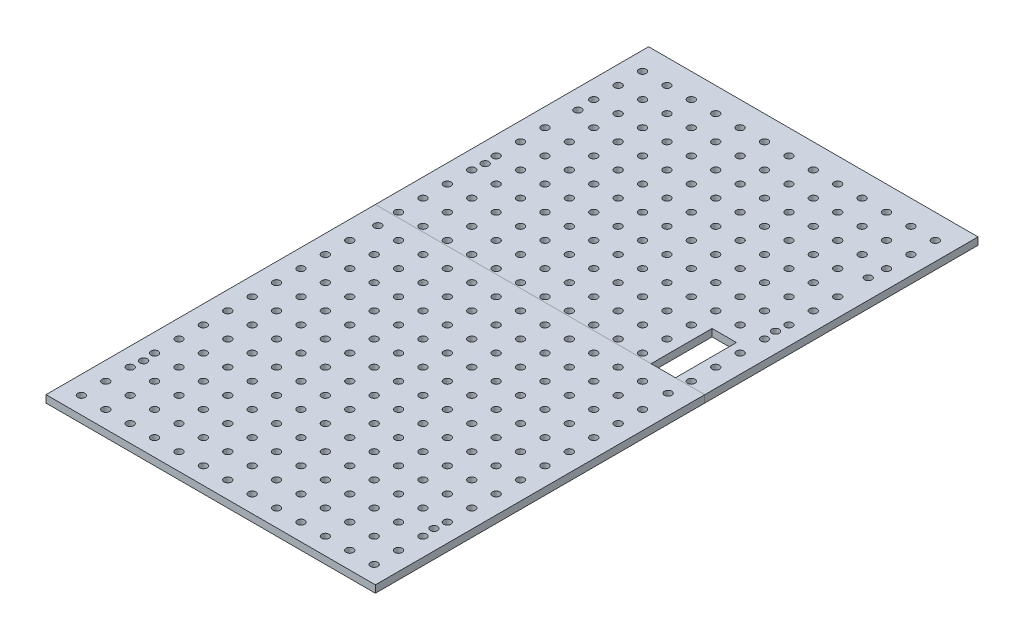
from build123d import *

# Parameters (mm, degrees)
SKETCH1_W               = 135
SKETCH1_H               = 247
BOSS_EXTRUDE1_DEPTH     = 3
CUT_EXTRUDE3_REACH      = 142.775
SKETCH5_R               = 1.5
SKETCH5_W               = 10
SKETCH5_H               = 25
CUT_EXTRUDE5_DEPTH      = 100
CUT_EXTRUDE5_DEPTH_BACK = 141.774642603
SKETCH6_R               = 1.5
BOSS_EXTRUDE2_START     = 2
SKETCH7_R               = 2.5
SKETCH7_R_2             = 1.5
BOSS_EXTRUDE2_DEPTH     = 2


# Read off the part's stored shape, not the designer's step: Split1
with BuildPart() as part:
    # Sketch1 → Boss-Extrude1 (new body)
    with BuildSketch(Plane(origin=(0, 0, 0), x_dir=(1, 0, 0), z_dir=(0, 1, 0))):
        Rectangle(SKETCH1_W, SKETCH1_H)
    extrude(amount=BOSS_EXTRUDE1_DEPTH)

    # Sketch5 → Cut-Extrude3 (cut, up to next)
    with BuildSketch(Plane.XZ, mode=Mode.PRIVATE) as cut_extrude3_sk1:
        with Locations(Location((59.5, 91.5, 0), (0, 0, 270))):
            Circle(SKETCH5_R)
    cut_extrude3_tool1 = extrude(cut_extrude3_sk1.sketch, amount=-CUT_EXTRUDE3_REACH, mode=Mode.PRIVATE) & part.part
    # Sketch5 → Cut-Extrude3 (cut, up to next)
    with BuildSketch(Plane.XZ, mode=Mode.PRIVATE) as cut_extrude3_sk2:
        with Locations(Location((59.5, -4.5, 0), (0, 0, 270))):
            Circle(SKETCH5_R)
    cut_extrude3_tool2 = extrude(cut_extrude3_sk2.sketch, amount=-CUT_EXTRUDE3_REACH, mode=Mode.PRIVATE) & part.part
    # Sketch5 → Cut-Extrude3 (cut, up to next)
    with BuildSketch(Plane.XZ, mode=Mode.PRIVATE) as cut_extrude3_sk3:
        with Locations(Location((59.5, -48.5, 0), (0, 0, 270))):
            Circle(SKETCH5_R)
    cut_extrude3_tool3 = extrude(cut_extrude3_sk3.sketch, amount=-CUT_EXTRUDE3_REACH, mode=Mode.PRIVATE) & part.part
    # Sketch5 → Cut-Extrude3 (cut, up to next)
    with BuildSketch(Plane.XZ, mode=Mode.PRIVATE) as cut_extrude3_sk4:
        with Locations(Location((59.5, -86.5, 0), (0, 0, 270))):
            Circle(SKETCH5_R)
    cut_extrude3_tool4 = extrude(cut_extrude3_sk4.sketch, amount=-CUT_EXTRUDE3_REACH, mode=Mode.PRIVATE) & part.part
    # Sketch5 → Cut-Extrude3 (cut, up to next)
    with BuildSketch(Plane.XZ, mode=Mode.PRIVATE) as cut_extrude3_sk5:
        with Locations(Location((-59.5, -86.5, 0), (0, 0, 270))):
            Circle(SKETCH5_R)
    cut_extrude3_tool5 = extrude(cut_extrude3_sk5.sketch, amount=-CUT_EXTRUDE3_REACH, mode=Mode.PRIVATE) & part.part
    # Sketch5 → Cut-Extrude3 (cut, up to next)
    with BuildSketch(Plane.XZ, mode=Mode.PRIVATE) as cut_extrude3_sk6:
        with Locations(Location((-59.5, -48.5, 0), (0, 0, 270))):
            Circle(SKETCH5_R)
    cut_extrude3_tool6 = extrude(cut_extrude3_sk6.sketch, amount=-CUT_EXTRUDE3_REACH, mode=Mode.PRIVATE) & part.part
    # Sketch5 → Cut-Extrude3 (cut, up to next)
    with BuildSketch(Plane.XZ, mode=Mode.PRIVATE) as cut_extrude3_sk7:
        with Locations(Location((-59.5, -4.5, 0), (0, 0, 270))):
            Circle(SKETCH5_R)
    cut_extrude3_tool7 = extrude(cut_extrude3_sk7.sketch, amount=-CUT_EXTRUDE3_REACH, mode=Mode.PRIVATE) & part.part
    # Sketch5 → Cut-Extrude3 (cut, up to next)
    with BuildSketch(Plane.XZ, mode=Mode.PRIVATE) as cut_extrude3_sk8:
        with Locations(Location((-59.5, 91.5, 0), (0, 0, 270))):
            Circle(SKETCH5_R)
    cut_extrude3_tool8 = extrude(cut_extrude3_sk8.sketch, amount=-CUT_EXTRUDE3_REACH, mode=Mode.PRIVATE) & part.part
    # Sketch5 → Cut-Extrude3 (cut, up to next)
    with BuildSketch(Plane.XZ, mode=Mode.PRIVATE) as cut_extrude3_sk9:
        with Locations((50.5, -24)):
            Rectangle(SKETCH5_W, SKETCH5_H)
    cut_extrude3_tool9 = extrude(cut_extrude3_sk9.sketch, amount=-CUT_EXTRUDE3_REACH, mode=Mode.PRIVATE) & part.part
    add(cut_extrude3_tool1.solids().sort_by_distance((59.5, 0, 91.5))[0], mode=Mode.SUBTRACT)
    add(cut_extrude3_tool2.solids().sort_by_distance((59.5, 0, -4.5))[0], mode=Mode.SUBTRACT)
    add(cut_extrude3_tool3.solids().sort_by_distance((59.5, 0, -48.5))[0], mode=Mode.SUBTRACT)
    add(cut_extrude3_tool4.solids().sort_by_distance((59.5, 0, -86.5))[0], mode=Mode.SUBTRACT)
    add(cut_extrude3_tool5.solids().sort_by_distance((-59.5, 0, -86.5))[0], mode=Mode.SUBTRACT)
    add(cut_extrude3_tool6.solids().sort_by_distance((-59.5, 0, -48.5))[0], mode=Mode.SUBTRACT)
    add(cut_extrude3_tool7.solids().sort_by_distance((-59.5, 0, -4.5))[0], mode=Mode.SUBTRACT)
    add(cut_extrude3_tool8.solids().sort_by_distance((-59.5, 0, 91.5))[0], mode=Mode.SUBTRACT)
    add(cut_extrude3_tool9.solids().sort_by_distance((50.5, 0, -24))[0], mode=Mode.SUBTRACT)

    # Sketch6 → Cut-Extrude5 (cut, two sides: drawn at the far end of the back side and taken through both)
    with BuildSketch(Plane(origin=(0, 3, 0), x_dir=(1, 0, 0), z_dir=(0, 1, 0)).offset(-CUT_EXTRUDE5_DEPTH_BACK)):
        with Locations(Location((0, 113.5, 0), (0, 0, 270))):
            Circle(SKETCH6_R)
        with Locations(Location((10, 113.5, 0), (0, 0, 270))):
            Circle(SKETCH6_R)
        with Locations(Location((20, 113.5, 0), (0, 0, 270))):
            Circle(SKETCH6_R)
        with Locations(Location((30, 113.5, 0), (0, 0, 270))):
            Circle(SKETCH6_R)
        with Locations(Location((40, 113.5, 0), (0, 0, 270))):
            Circle(SKETCH6_R)
        with Locations(Location((50, 113.5, 0), (0, 0, 270))):
            Circle(SKETCH6_R)
        with Locations(Location((10, 103.5, 0), (0, 0, 270))):
            Circle(SKETCH6_R)
        with Locations(Location((20, 103.5, 0), (0, 0, 270))):
            Circle(SKETCH6_R)
        with Locations(Location((30, 103.5, 0), (0, 0, 270))):
            Circle(SKETCH6_R)
        with Locations(Location((40, 103.5, 0), (0, 0, 270))):
            Circle(SKETCH6_R)
        with Locations(Location((50, 103.5, 0), (0, 0, 270))):
            Circle(SKETCH6_R)
        with Locations(Location((10, 93.5, 0), (0, 0, 270))):
            Circle(SKETCH6_R)
        with Locations(Location((20, 93.5, 0), (0, 0, 270))):
            Circle(SKETCH6_R)
        with Locations(Location((30, 93.5, 0), (0, 0, 270))):
            Circle(SKETCH6_R)
        with Locations(Location((40, 93.5, 0), (0, 0, 270))):
            Circle(SKETCH6_R)
        with Locations(Location((50, 93.5, 0), (0, 0, 270))):
            Circle(SKETCH6_R)
        with Locations(Location((10, 83.5, 0), (0, 0, 270))):
            Circle(SKETCH6_R)
        with Locations(Location((20, 83.5, 0), (0, 0, 270))):
            Circle(SKETCH6_R)
        with Locations(Location((30, 83.5, 0), (0, 0, 270))):
            Circle(SKETCH6_R)
        with Locations(Location((40, 83.5, 0), (0, 0, 270))):
            Circle(SKETCH6_R)
        with Locations(Location((50, 83.5, 0), (0, 0, 270))):
            Circle(SKETCH6_R)
        with Locations(Location((10, 73.5, 0), (0, 0, 270))):
            Circle(SKETCH6_R)
        with Locations(Location((20, 73.5, 0), (0, 0, 270))):
            Circle(SKETCH6_R)
        with Locations(Location((30, 73.5, 0), (0, 0, 270))):
            Circle(SKETCH6_R)
        with Locations(Location((40, 73.5, 0), (0, 0, 270))):
            Circle(SKETCH6_R)
        with Locations(Location((50, 73.5, 0), (0, 0, 270))):
            Circle(SKETCH6_R)
        with Locations(Location((10, 63.5, 0), (0, 0, 270))):
            Circle(SKETCH6_R)
        with Locations(Location((20, 63.5, 0), (0, 0, 270))):
            Circle(SKETCH6_R)
        with Locations(Location((30, 63.5, 0), (0, 0, 270))):
            Circle(SKETCH6_R)
        with Locations(Location((40, 63.5, 0), (0, 0, 270))):
            Circle(SKETCH6_R)
        with Locations(Location((50, 63.5, 0), (0, 0, 270))):
            Circle(SKETCH6_R)
        with Locations(Location((10, 53.5, 0), (0, 0, 270))):
            Circle(SKETCH6_R)
        with Locations(Location((20, 53.5, 0), (0, 0, 270))):
            Circle(SKETCH6_R)
        with Locations(Location((30, 53.5, 0), (0, 0, 270))):
            Circle(SKETCH6_R)
        with Locations(Location((40, 53.5, 0), (0, 0, 270))):
            Circle(SKETCH6_R)
        with Locations(Location((50, 53.5, 0), (0, 0, 270))):
            Circle(SKETCH6_R)
        with Locations(Location((10, 43.5, 0), (0, 0, 270))):
            Circle(SKETCH6_R)
        with Locations(Location((20, 43.5, 0), (0, 0, 270))):
            Circle(SKETCH6_R)
        with Locations(Location((30, 43.5, 0), (0, 0, 270))):
            Circle(SKETCH6_R)
        with Locations(Location((40, 43.5, 0), (0, 0, 270))):
            Circle(SKETCH6_R)
        with Locations(Location((50, 43.5, 0), (0, 0, 270))):
            Circle(SKETCH6_R)
        with Locations(Location((10, 33.5, 0), (0, 0, 270))):
            Circle(SKETCH6_R)
        with Locations(Location((20, 33.5, 0), (0, 0, 270))):
            Circle(SKETCH6_R)
        with Locations(Location((30, 33.5, 0), (0, 0, 270))):
            Circle(SKETCH6_R)
        with Locations(Location((40, 33.5, 0), (0, 0, 270))):
            Circle(SKETCH6_R)
        with Locations((50, 33.5)):
            Circle(SKETCH6_R)
        with Locations(Location((10, 23.5, 0), (0, 0, 270))):
            Circle(SKETCH6_R)
        with Locations(Location((20, 23.5, 0), (0, 0, 270))):
            Circle(SKETCH6_R)
        with Locations(Location((30, 23.5, 0), (0, 0, 270))):
            Circle(SKETCH6_R)
        with Locations(Location((40, 23.5, 0), (0, 0, 270))):
            Circle(SKETCH6_R)
        with Locations((50, 23.5)):
            Circle(SKETCH6_R)
        with Locations(Location((10, 13.5, 0), (0, 0, 270))):
            Circle(SKETCH6_R)
        with Locations(Location((20, 13.5, 0), (0, 0, 270))):
            Circle(SKETCH6_R)
        with Locations(Location((30, 13.5, 0), (0, 0, 270))):
            Circle(SKETCH6_R)
        with Locations(Location((40, 13.5, 0), (0, 0, 270))):
            Circle(SKETCH6_R)
        with Locations((50, 13.5)):
            Circle(SKETCH6_R)
        with Locations(Location((10, 3.5, 0), (0, 0, 270))):
            Circle(SKETCH6_R)
        with Locations(Location((20, 3.5, 0), (0, 0, 270))):
            Circle(SKETCH6_R)
        with Locations(Location((30, 3.5, 0), (0, 0, 270))):
            Circle(SKETCH6_R)
        with Locations(Location((40, 3.5, 0), (0, 0, 270))):
            Circle(SKETCH6_R)
        with Locations(Location((50, 3.5, 0), (0, 0, 270))):
            Circle(SKETCH6_R)
        with Locations(Location((10, -6.5, 0), (0, 0, 270))):
            Circle(SKETCH6_R)
        with Locations(Location((20, -6.5, 0), (0, 0, 270))):
            Circle(SKETCH6_R)
        with Locations(Location((30, -6.5, 0), (0, 0, 270))):
            Circle(SKETCH6_R)
        with Locations(Location((40, -6.5, 0), (0, 0, 270))):
            Circle(SKETCH6_R)
        with Locations(Location((50, -6.5, 0), (0, 0, 270))):
            Circle(SKETCH6_R)
        with Locations(Location((10, -16.5, 0), (0, 0, 270))):
            Circle(SKETCH6_R)
        with Locations(Location((20, -16.5, 0), (0, 0, 270))):
            Circle(SKETCH6_R)
        with Locations(Location((30, -16.5, 0), (0, 0, 270))):
            Circle(SKETCH6_R)
        with Locations(Location((40, -16.5, 0), (0, 0, 270))):
            Circle(SKETCH6_R)
        with Locations(Location((50, -16.5, 0), (0, 0, 270))):
            Circle(SKETCH6_R)
        with Locations(Location((10, -26.5, 0), (0, 0, 270))):
            Circle(SKETCH6_R)
        with Locations(Location((20, -26.5, 0), (0, 0, 270))):
            Circle(SKETCH6_R)
        with Locations(Location((30, -26.5, 0), (0, 0, 270))):
            Circle(SKETCH6_R)
        with Locations(Location((40, -26.5, 0), (0, 0, 270))):
            Circle(SKETCH6_R)
        with Locations(Location((50, -26.5, 0), (0, 0, 270))):
            Circle(SKETCH6_R)
        with Locations(Location((10, -36.5, 0), (0, 0, 270))):
            Circle(SKETCH6_R)
        with Locations(Location((20, -36.5, 0), (0, 0, 270))):
            Circle(SKETCH6_R)
        with Locations(Location((30, -36.5, 0), (0, 0, 270))):
            Circle(SKETCH6_R)
        with Locations(Location((40, -36.5, 0), (0, 0, 270))):
            Circle(SKETCH6_R)
        with Locations(Location((50, -36.5, 0), (0, 0, 270))):
            Circle(SKETCH6_R)
        with Locations(Location((10, -46.5, 0), (0, 0, 270))):
            Circle(SKETCH6_R)
        with Locations(Location((20, -46.5, 0), (0, 0, 270))):
            Circle(SKETCH6_R)
        with Locations(Location((30, -46.5, 0), (0, 0, 270))):
            Circle(SKETCH6_R)
        with Locations(Location((40, -46.5, 0), (0, 0, 270))):
            Circle(SKETCH6_R)
        with Locations(Location((50, -46.5, 0), (0, 0, 270))):
            Circle(SKETCH6_R)
        with Locations(Location((10, -56.5, 0), (0, 0, 270))):
            Circle(SKETCH6_R)
        with Locations(Location((20, -56.5, 0), (0, 0, 270))):
            Circle(SKETCH6_R)
        with Locations(Location((30, -56.5, 0), (0, 0, 270))):
            Circle(SKETCH6_R)
        with Locations(Location((40, -56.5, 0), (0, 0, 270))):
            Circle(SKETCH6_R)
        with Locations(Location((50, -56.5, 0), (0, 0, 270))):
            Circle(SKETCH6_R)
        with Locations(Location((10, -66.5, 0), (0, 0, 270))):
            Circle(SKETCH6_R)
        with Locations(Location((20, -66.5, 0), (0, 0, 270))):
            Circle(SKETCH6_R)
        with Locations(Location((30, -66.5, 0), (0, 0, 270))):
            Circle(SKETCH6_R)
        with Locations(Location((40, -66.5, 0), (0, 0, 270))):
            Circle(SKETCH6_R)
        with Locations(Location((50, -66.5, 0), (0, 0, 270))):
            Circle(SKETCH6_R)
        with Locations(Location((10, -76.5, 0), (0, 0, 270))):
            Circle(SKETCH6_R)
        with Locations(Location((20, -76.5, 0), (0, 0, 270))):
            Circle(SKETCH6_R)
        with Locations(Location((30, -76.5, 0), (0, 0, 270))):
            Circle(SKETCH6_R)
        with Locations(Location((40, -76.5, 0), (0, 0, 270))):
            Circle(SKETCH6_R)
        with Locations(Location((50, -76.5, 0), (0, 0, 270))):
            Circle(SKETCH6_R)
        with Locations(Location((10, -86.5, 0), (0, 0, 270))):
            Circle(SKETCH6_R)
        with Locations(Location((20, -86.5, 0), (0, 0, 270))):
            Circle(SKETCH6_R)
        with Locations(Location((30, -86.5, 0), (0, 0, 270))):
            Circle(SKETCH6_R)
        with Locations(Location((40, -86.5, 0), (0, 0, 270))):
            Circle(SKETCH6_R)
        with Locations(Location((50, -86.5, 0), (0, 0, 270))):
            Circle(SKETCH6_R)
        with Locations(Location((10, -96.5, 0), (0, 0, 270))):
            Circle(SKETCH6_R)
        with Locations(Location((20, -96.5, 0), (0, 0, 270))):
            Circle(SKETCH6_R)
        with Locations(Location((30, -96.5, 0), (0, 0, 270))):
            Circle(SKETCH6_R)
        with Locations(Location((40, -96.5, 0), (0, 0, 270))):
            Circle(SKETCH6_R)
        with Locations(Location((50, -96.5, 0), (0, 0, 270))):
            Circle(SKETCH6_R)
        with Locations(Location((10, -106.5, 0), (0, 0, 270))):
            Circle(SKETCH6_R)
        with Locations(Location((20, -106.5, 0), (0, 0, 270))):
            Circle(SKETCH6_R)
        with Locations(Location((30, -106.5, 0), (0, 0, 270))):
            Circle(SKETCH6_R)
        with Locations(Location((40, -106.5, 0), (0, 0, 270))):
            Circle(SKETCH6_R)
        with Locations(Location((50, -106.5, 0), (0, 0, 270))):
            Circle(SKETCH6_R)
        with Locations(Location((10, -116.5, 0), (0, 0, 270))):
            Circle(SKETCH6_R)
        with Locations(Location((20, -116.5, 0), (0, 0, 270))):
            Circle(SKETCH6_R)
        with Locations(Location((30, -116.5, 0), (0, 0, 270))):
            Circle(SKETCH6_R)
        with Locations(Location((40, -116.5, 0), (0, 0, 270))):
            Circle(SKETCH6_R)
        with Locations(Location((50, -116.5, 0), (0, 0, 270))):
            Circle(SKETCH6_R)
        with Locations(Location((0, 103.5, 0), (0, 0, 270))):
            Circle(SKETCH6_R)
        with Locations(Location((0, 93.5, 0), (0, 0, 270))):
            Circle(SKETCH6_R)
        with Locations(Location((0, 83.5, 0), (0, 0, 270))):
            Circle(SKETCH6_R)
        with Locations(Location((0, 73.5, 0), (0, 0, 270))):
            Circle(SKETCH6_R)
        with Locations(Location((0, 63.5, 0), (0, 0, 270))):
            Circle(SKETCH6_R)
        with Locations(Location((0, 53.5, 0), (0, 0, 270))):
            Circle(SKETCH6_R)
        with Locations(Location((0, 43.5, 0), (0, 0, 270))):
            Circle(SKETCH6_R)
        with Locations(Location((0, 33.5, 0), (0, 0, 270))):
            Circle(SKETCH6_R)
        with Locations(Location((0, 23.5, 0), (0, 0, 270))):
            Circle(SKETCH6_R)
        with Locations(Location((0, 13.5, 0), (0, 0, 270))):
            Circle(SKETCH6_R)
        with Locations(Location((0, 3.5, 0), (0, 0, 270))):
            Circle(SKETCH6_R)
        with Locations(Location((0, -6.5, 0), (0, 0, 270))):
            Circle(SKETCH6_R)
        with Locations(Location((0, -16.5, 0), (0, 0, 270))):
            Circle(SKETCH6_R)
        with Locations(Location((0, -26.5, 0), (0, 0, 270))):
            Circle(SKETCH6_R)
        with Locations(Location((0, -36.5, 0), (0, 0, 270))):
            Circle(SKETCH6_R)
        with Locations(Location((0, -46.5, 0), (0, 0, 270))):
            Circle(SKETCH6_R)
        with Locations(Location((0, -56.5, 0), (0, 0, 270))):
            Circle(SKETCH6_R)
        with Locations(Location((0, -66.5, 0), (0, 0, 270))):
            Circle(SKETCH6_R)
        with Locations(Location((0, -76.5, 0), (0, 0, 270))):
            Circle(SKETCH6_R)
        with Locations(Location((0, -86.5, 0), (0, 0, 270))):
            Circle(SKETCH6_R)
        with Locations(Location((0, -96.5, 0), (0, 0, 270))):
            Circle(SKETCH6_R)
        with Locations(Location((0, -106.5, 0), (0, 0, 270))):
            Circle(SKETCH6_R)
        with Locations(Location((0, -116.5, 0), (0, 0, 270))):
            Circle(SKETCH6_R)
        with Locations(Location((-50, -116.5, 0), (0, 0, 90))):
            Circle(SKETCH6_R)
        with Locations(Location((-40, -116.5, 0), (0, 0, 90))):
            Circle(SKETCH6_R)
        with Locations(Location((-30, -116.5, 0), (0, 0, 90))):
            Circle(SKETCH6_R)
        with Locations(Location((-20, -116.5, 0), (0, 0, 90))):
            Circle(SKETCH6_R)
        with Locations(Location((-10, -116.5, 0), (0, 0, 90))):
            Circle(SKETCH6_R)
        with Locations(Location((-50, -106.5, 0), (0, 0, 90))):
            Circle(SKETCH6_R)
        with Locations(Location((-40, -106.5, 0), (0, 0, 90))):
            Circle(SKETCH6_R)
        with Locations(Location((-30, -106.5, 0), (0, 0, 90))):
            Circle(SKETCH6_R)
        with Locations(Location((-20, -106.5, 0), (0, 0, 90))):
            Circle(SKETCH6_R)
        with Locations(Location((-10, -106.5, 0), (0, 0, 90))):
            Circle(SKETCH6_R)
        with Locations(Location((-50, -96.5, 0), (0, 0, 90))):
            Circle(SKETCH6_R)
        with Locations(Location((-40, -96.5, 0), (0, 0, 90))):
            Circle(SKETCH6_R)
        with Locations(Location((-30, -96.5, 0), (0, 0, 90))):
            Circle(SKETCH6_R)
        with Locations(Location((-20, -96.5, 0), (0, 0, 90))):
            Circle(SKETCH6_R)
        with Locations(Location((-10, -96.5, 0), (0, 0, 90))):
            Circle(SKETCH6_R)
        with Locations(Location((-50, -86.5, 0), (0, 0, 90))):
            Circle(SKETCH6_R)
        with Locations(Location((-40, -86.5, 0), (0, 0, 90))):
            Circle(SKETCH6_R)
        with Locations(Location((-30, -86.5, 0), (0, 0, 90))):
            Circle(SKETCH6_R)
        with Locations(Location((-20, -86.5, 0), (0, 0, 90))):
            Circle(SKETCH6_R)
        with Locations(Location((-10, -86.5, 0), (0, 0, 90))):
            Circle(SKETCH6_R)
        with Locations(Location((-50, -76.5, 0), (0, 0, 90))):
            Circle(SKETCH6_R)
        with Locations(Location((-40, -76.5, 0), (0, 0, 90))):
            Circle(SKETCH6_R)
        with Locations(Location((-30, -76.5, 0), (0, 0, 90))):
            Circle(SKETCH6_R)
        with Locations(Location((-20, -76.5, 0), (0, 0, 90))):
            Circle(SKETCH6_R)
        with Locations(Location((-10, -76.5, 0), (0, 0, 90))):
            Circle(SKETCH6_R)
        with Locations(Location((-50, -66.5, 0), (0, 0, 90))):
            Circle(SKETCH6_R)
        with Locations(Location((-40, -66.5, 0), (0, 0, 90))):
            Circle(SKETCH6_R)
        with Locations(Location((-30, -66.5, 0), (0, 0, 90))):
            Circle(SKETCH6_R)
        with Locations(Location((-20, -66.5, 0), (0, 0, 90))):
            Circle(SKETCH6_R)
        with Locations(Location((-10, -66.5, 0), (0, 0, 90))):
            Circle(SKETCH6_R)
        with Locations(Location((-50, -56.5, 0), (0, 0, 90))):
            Circle(SKETCH6_R)
        with Locations(Location((-40, -56.5, 0), (0, 0, 90))):
            Circle(SKETCH6_R)
        with Locations(Location((-30, -56.5, 0), (0, 0, 90))):
            Circle(SKETCH6_R)
        with Locations(Location((-20, -56.5, 0), (0, 0, 90))):
            Circle(SKETCH6_R)
        with Locations(Location((-10, -56.5, 0), (0, 0, 90))):
            Circle(SKETCH6_R)
        with Locations(Location((-50, -46.5, 0), (0, 0, 90))):
            Circle(SKETCH6_R)
        with Locations(Location((-40, -46.5, 0), (0, 0, 90))):
            Circle(SKETCH6_R)
        with Locations(Location((-30, -46.5, 0), (0, 0, 90))):
            Circle(SKETCH6_R)
        with Locations(Location((-20, -46.5, 0), (0, 0, 90))):
            Circle(SKETCH6_R)
        with Locations(Location((-10, -46.5, 0), (0, 0, 90))):
            Circle(SKETCH6_R)
        with Locations(Location((-50, -36.5, 0), (0, 0, 90))):
            Circle(SKETCH6_R)
        with Locations(Location((-40, -36.5, 0), (0, 0, 90))):
            Circle(SKETCH6_R)
        with Locations(Location((-30, -36.5, 0), (0, 0, 90))):
            Circle(SKETCH6_R)
        with Locations(Location((-20, -36.5, 0), (0, 0, 90))):
            Circle(SKETCH6_R)
        with Locations(Location((-10, -36.5, 0), (0, 0, 90))):
            Circle(SKETCH6_R)
        with Locations(Location((-50, -26.5, 0), (0, 0, 90))):
            Circle(SKETCH6_R)
        with Locations(Location((-40, -26.5, 0), (0, 0, 90))):
            Circle(SKETCH6_R)
        with Locations(Location((-30, -26.5, 0), (0, 0, 90))):
            Circle(SKETCH6_R)
        with Locations(Location((-20, -26.5, 0), (0, 0, 90))):
            Circle(SKETCH6_R)
        with Locations(Location((-10, -26.5, 0), (0, 0, 90))):
            Circle(SKETCH6_R)
        with Locations(Location((-50, -16.5, 0), (0, 0, 90))):
            Circle(SKETCH6_R)
        with Locations(Location((-40, -16.5, 0), (0, 0, 90))):
            Circle(SKETCH6_R)
        with Locations(Location((-30, -16.5, 0), (0, 0, 90))):
            Circle(SKETCH6_R)
        with Locations(Location((-20, -16.5, 0), (0, 0, 90))):
            Circle(SKETCH6_R)
        with Locations(Location((-10, -16.5, 0), (0, 0, 90))):
            Circle(SKETCH6_R)
        with Locations(Location((-50, -6.5, 0), (0, 0, 90))):
            Circle(SKETCH6_R)
        with Locations(Location((-40, -6.5, 0), (0, 0, 90))):
            Circle(SKETCH6_R)
        with Locations(Location((-30, -6.5, 0), (0, 0, 90))):
            Circle(SKETCH6_R)
        with Locations(Location((-20, -6.5, 0), (0, 0, 90))):
            Circle(SKETCH6_R)
        with Locations(Location((-10, -6.5, 0), (0, 0, 90))):
            Circle(SKETCH6_R)
        with Locations(Location((-50, 3.5, 0), (0, 0, 90))):
            Circle(SKETCH6_R)
        with Locations(Location((-40, 3.5, 0), (0, 0, 90))):
            Circle(SKETCH6_R)
        with Locations(Location((-30, 3.5, 0), (0, 0, 90))):
            Circle(SKETCH6_R)
        with Locations(Location((-20, 3.5, 0), (0, 0, 90))):
            Circle(SKETCH6_R)
        with Locations(Location((-10, 3.5, 0), (0, 0, 90))):
            Circle(SKETCH6_R)
        with Locations(Location((-50, 13.5, 0), (0, 0, 90))):
            Circle(SKETCH6_R)
        with Locations(Location((-40, 13.5, 0), (0, 0, 90))):
            Circle(SKETCH6_R)
        with Locations(Location((-30, 13.5, 0), (0, 0, 90))):
            Circle(SKETCH6_R)
        with Locations(Location((-20, 13.5, 0), (0, 0, 90))):
            Circle(SKETCH6_R)
        with Locations(Location((-10, 13.5, 0), (0, 0, 90))):
            Circle(SKETCH6_R)
        with Locations(Location((-50, 23.5, 0), (0, 0, 90))):
            Circle(SKETCH6_R)
        with Locations(Location((-40, 23.5, 0), (0, 0, 90))):
            Circle(SKETCH6_R)
        with Locations(Location((-30, 23.5, 0), (0, 0, 90))):
            Circle(SKETCH6_R)
        with Locations(Location((-20, 23.5, 0), (0, 0, 90))):
            Circle(SKETCH6_R)
        with Locations(Location((-10, 23.5, 0), (0, 0, 90))):
            Circle(SKETCH6_R)
        with Locations(Location((-50, 33.5, 0), (0, 0, 90))):
            Circle(SKETCH6_R)
        with Locations(Location((-40, 33.5, 0), (0, 0, 90))):
            Circle(SKETCH6_R)
        with Locations(Location((-30, 33.5, 0), (0, 0, 90))):
            Circle(SKETCH6_R)
        with Locations(Location((-20, 33.5, 0), (0, 0, 90))):
            Circle(SKETCH6_R)
        with Locations(Location((-10, 33.5, 0), (0, 0, 90))):
            Circle(SKETCH6_R)
        with Locations(Location((-50, 43.5, 0), (0, 0, 90))):
            Circle(SKETCH6_R)
        with Locations(Location((-40, 43.5, 0), (0, 0, 90))):
            Circle(SKETCH6_R)
        with Locations(Location((-30, 43.5, 0), (0, 0, 90))):
            Circle(SKETCH6_R)
        with Locations(Location((-20, 43.5, 0), (0, 0, 90))):
            Circle(SKETCH6_R)
        with Locations(Location((-10, 43.5, 0), (0, 0, 90))):
            Circle(SKETCH6_R)
        with Locations(Location((-50, 53.5, 0), (0, 0, 90))):
            Circle(SKETCH6_R)
        with Locations(Location((-40, 53.5, 0), (0, 0, 90))):
            Circle(SKETCH6_R)
        with Locations(Location((-30, 53.5, 0), (0, 0, 90))):
            Circle(SKETCH6_R)
        with Locations(Location((-20, 53.5, 0), (0, 0, 90))):
            Circle(SKETCH6_R)
        with Locations(Location((-10, 53.5, 0), (0, 0, 90))):
            Circle(SKETCH6_R)
        with Locations(Location((-50, 63.5, 0), (0, 0, 90))):
            Circle(SKETCH6_R)
        with Locations(Location((-40, 63.5, 0), (0, 0, 90))):
            Circle(SKETCH6_R)
        with Locations(Location((-30, 63.5, 0), (0, 0, 90))):
            Circle(SKETCH6_R)
        with Locations(Location((-20, 63.5, 0), (0, 0, 90))):
            Circle(SKETCH6_R)
        with Locations(Location((-10, 63.5, 0), (0, 0, 90))):
            Circle(SKETCH6_R)
        with Locations(Location((-50, 73.5, 0), (0, 0, 90))):
            Circle(SKETCH6_R)
        with Locations(Location((-40, 73.5, 0), (0, 0, 90))):
            Circle(SKETCH6_R)
        with Locations(Location((-30, 73.5, 0), (0, 0, 90))):
            Circle(SKETCH6_R)
        with Locations(Location((-20, 73.5, 0), (0, 0, 90))):
            Circle(SKETCH6_R)
        with Locations(Location((-10, 73.5, 0), (0, 0, 90))):
            Circle(SKETCH6_R)
        with Locations(Location((-50, 83.5, 0), (0, 0, 90))):
            Circle(SKETCH6_R)
        with Locations(Location((-40, 83.5, 0), (0, 0, 90))):
            Circle(SKETCH6_R)
        with Locations(Location((-30, 83.5, 0), (0, 0, 90))):
            Circle(SKETCH6_R)
        with Locations(Location((-20, 83.5, 0), (0, 0, 90))):
            Circle(SKETCH6_R)
        with Locations(Location((-10, 83.5, 0), (0, 0, 90))):
            Circle(SKETCH6_R)
        with Locations(Location((-50, 93.5, 0), (0, 0, 90))):
            Circle(SKETCH6_R)
        with Locations(Location((-40, 93.5, 0), (0, 0, 90))):
            Circle(SKETCH6_R)
        with Locations(Location((-30, 93.5, 0), (0, 0, 90))):
            Circle(SKETCH6_R)
        with Locations(Location((-20, 93.5, 0), (0, 0, 90))):
            Circle(SKETCH6_R)
        with Locations(Location((-10, 93.5, 0), (0, 0, 90))):
            Circle(SKETCH6_R)
        with Locations(Location((-50, 103.5, 0), (0, 0, 90))):
            Circle(SKETCH6_R)
        with Locations(Location((-40, 103.5, 0), (0, 0, 90))):
            Circle(SKETCH6_R)
        with Locations(Location((-30, 103.5, 0), (0, 0, 90))):
            Circle(SKETCH6_R)
        with Locations(Location((-20, 103.5, 0), (0, 0, 90))):
            Circle(SKETCH6_R)
        with Locations(Location((-10, 103.5, 0), (0, 0, 90))):
            Circle(SKETCH6_R)
        with Locations(Location((-50, 113.5, 0), (0, 0, 90))):
            Circle(SKETCH6_R)
        with Locations(Location((-40, 113.5, 0), (0, 0, 90))):
            Circle(SKETCH6_R)
        with Locations(Location((-30, 113.5, 0), (0, 0, 90))):
            Circle(SKETCH6_R)
        with Locations(Location((-20, 113.5, 0), (0, 0, 90))):
            Circle(SKETCH6_R)
        with Locations(Location((-10, 113.5, 0), (0, 0, 90))):
            Circle(SKETCH6_R)
        with Locations(Location((-60, -116.5, 0), (0, 0, 90))):
            Circle(SKETCH6_R)
        with Locations(Location((-60, -106.5, 0), (0, 0, 90))):
            Circle(SKETCH6_R)
        with Locations(Location((-60, -96.5, 0), (0, 0, 90))):
            Circle(SKETCH6_R)
        with Locations(Location((-60, -86.5, 0), (0, 0, 90))):
            Circle(SKETCH6_R)
        with Locations(Location((-60, -76.5, 0), (0, 0, 90))):
            Circle(SKETCH6_R)
        with Locations(Location((-60, -66.5, 0), (0, 0, 90))):
            Circle(SKETCH6_R)
        with Locations(Location((-60, -56.5, 0), (0, 0, 90))):
            Circle(SKETCH6_R)
        with Locations(Location((-60, -46.5, 0), (0, 0, 90))):
            Circle(SKETCH6_R)
        with Locations(Location((-60, -36.5, 0), (0, 0, 90))):
            Circle(SKETCH6_R)
        with Locations(Location((-60, -26.5, 0), (0, 0, 90))):
            Circle(SKETCH6_R)
        with Locations(Location((-60, -16.5, 0), (0, 0, 90))):
            Circle(SKETCH6_R)
        with Locations(Location((-60, -6.5, 0), (0, 0, 90))):
            Circle(SKETCH6_R)
        with Locations(Location((-60, 13.5, 0), (0, 0, 90))):
            Circle(SKETCH6_R)
        with Locations(Location((-60, 23.5, 0), (0, 0, 90))):
            Circle(SKETCH6_R)
        with Locations(Location((-60, 33.5, 0), (0, 0, 90))):
            Circle(SKETCH6_R)
        with Locations(Location((-60, 43.5, 0), (0, 0, 90))):
            Circle(SKETCH6_R)
        with Locations(Location((-60, 53.5, 0), (0, 0, 90))):
            Circle(SKETCH6_R)
        with Locations(Location((-60, 63.5, 0), (0, 0, 90))):
            Circle(SKETCH6_R)
        with Locations(Location((-60, 73.5, 0), (0, 0, 90))):
            Circle(SKETCH6_R)
        with Locations(Location((-60, 93.5, 0), (0, 0, 90))):
            Circle(SKETCH6_R)
        with Locations(Location((-60, 103.5, 0), (0, 0, 90))):
            Circle(SKETCH6_R)
        with Locations(Location((-60, 113.5, 0), (0, 0, 90))):
            Circle(SKETCH6_R)
        with Locations(Location((60, 113.5, 0), (0, 0, 270))):
            Circle(SKETCH6_R)
        with Locations(Location((60, 103.5, 0), (0, 0, 270))):
            Circle(SKETCH6_R)
        with Locations(Location((60, 93.5, 0), (0, 0, 270))):
            Circle(SKETCH6_R)
        with Locations(Location((60, 73.5, 0), (0, 0, 270))):
            Circle(SKETCH6_R)
        with Locations(Location((60, 63.5, 0), (0, 0, 270))):
            Circle(SKETCH6_R)
        with Locations(Location((60, 53.5, 0), (0, 0, 270))):
            Circle(SKETCH6_R)
        with Locations(Location((60, 43.5, 0), (0, 0, 270))):
            Circle(SKETCH6_R)
        with Locations(Location((60, 33.5, 0), (0, 0, 270))):
            Circle(SKETCH6_R)
        with Locations(Location((60, 23.5, 0), (0, 0, 270))):
            Circle(SKETCH6_R)
        with Locations(Location((60, 13.5, 0), (0, 0, 270))):
            Circle(SKETCH6_R)
        with Locations(Location((60, -6.5, 0), (0, 0, 270))):
            Circle(SKETCH6_R)
        with Locations(Location((60, -16.5, 0), (0, 0, 270))):
            Circle(SKETCH6_R)
        with Locations(Location((60, -26.5, 0), (0, 0, 270))):
            Circle(SKETCH6_R)
        with Locations(Location((60, -36.5, 0), (0, 0, 270))):
            Circle(SKETCH6_R)
        with Locations(Location((60, -46.5, 0), (0, 0, 270))):
            Circle(SKETCH6_R)
        with Locations(Location((60, -56.5, 0), (0, 0, 270))):
            Circle(SKETCH6_R)
        with Locations(Location((60, -66.5, 0), (0, 0, 270))):
            Circle(SKETCH6_R)
        with Locations(Location((60, -76.5, 0), (0, 0, 270))):
            Circle(SKETCH6_R)
        with Locations(Location((60, -86.5, 0), (0, 0, 270))):
            Circle(SKETCH6_R)
        with Locations(Location((60, -96.5, 0), (0, 0, 270))):
            Circle(SKETCH6_R)
        with Locations(Location((60, -106.5, 0), (0, 0, 270))):
            Circle(SKETCH6_R)
        with Locations(Location((60, -116.5, 0), (0, 0, 270))):
            Circle(SKETCH6_R)
    extrude(amount=CUT_EXTRUDE5_DEPTH + CUT_EXTRUDE5_DEPTH_BACK, mode=Mode.SUBTRACT)

    # Sketch7 → Boss-Extrude2 (add)
    # profile 1 of 8: a face of its own
    with BuildSketch(Plane.XZ.offset(BOSS_EXTRUDE2_START)):
        with Locations(Location((59.5, -4.5, 0), (0, 0, 270))):
            Circle(SKETCH7_R)
        with Locations(Location((59.5, -4.5, 0), (0, 0, 270))):
            Circle(SKETCH7_R_2, mode=Mode.SUBTRACT)
    # profile 2 of 8: a face of its own
    with BuildSketch(Plane.XZ.offset(BOSS_EXTRUDE2_START)):
        with Locations(Location((59.5, -48.5, 0), (0, 0, 270))):
            Circle(SKETCH7_R)
        with Locations(Location((59.5, -48.5, 0), (0, 0, 270))):
            Circle(SKETCH7_R_2, mode=Mode.SUBTRACT)
    # profile 3 of 8: a face of its own
    with BuildSketch(Plane.XZ.offset(BOSS_EXTRUDE2_START)):
        with Locations(Location((59.5, -86.5, 0), (0, 0, 270))):
            Circle(SKETCH7_R)
        with Locations(Location((59.5, -86.5, 0), (0, 0, 270))):
            Circle(SKETCH7_R_2, mode=Mode.SUBTRACT)
    # profile 4 of 8: a face of its own
    with BuildSketch(Plane.XZ.offset(BOSS_EXTRUDE2_START)):
        with Locations(Location((-59.5, -86.5, 0), (0, 0, 270))):
            Circle(SKETCH7_R)
        with Locations(Location((-59.5, -86.5, 0), (0, 0, 270))):
            Circle(SKETCH7_R_2, mode=Mode.SUBTRACT)
    # profile 5 of 8: a face of its own
    with BuildSketch(Plane.XZ.offset(BOSS_EXTRUDE2_START)):
        with Locations(Location((-59.5, -48.5, 0), (0, 0, 270))):
            Circle(SKETCH7_R)
        with Locations(Location((-59.5, -48.5, 0), (0, 0, 270))):
            Circle(SKETCH7_R_2, mode=Mode.SUBTRACT)
    # profile 6 of 8: a face of its own
    with BuildSketch(Plane.XZ.offset(BOSS_EXTRUDE2_START)):
        with Locations(Location((-59.5, -4.5, 0), (0, 0, 270))):
            Circle(SKETCH7_R)
        with Locations(Location((-59.5, -4.5, 0), (0, 0, 270))):
            Circle(SKETCH7_R_2, mode=Mode.SUBTRACT)
    # profile 7 of 8: a face of its own
    with BuildSketch(Plane.XZ.offset(BOSS_EXTRUDE2_START)):
        with Locations(Location((-59.5, 91.5, 0), (0, 0, 270))):
            Circle(SKETCH7_R)
        with Locations(Location((-59.5, 91.5, 0), (0, 0, 270))):
            Circle(SKETCH7_R_2, mode=Mode.SUBTRACT)
    # profile 8 of 8: a face of its own
    with BuildSketch(Plane.XZ.offset(BOSS_EXTRUDE2_START)):
        with Locations(Location((59.5, 91.5, 0), (0, 0, 270))):
            Circle(SKETCH7_R)
        with Locations(Location((59.5, 91.5, 0), (0, 0, 270))):
            Circle(SKETCH7_R_2, mode=Mode.SUBTRACT)
    extrude(amount=-BOSS_EXTRUDE2_DEPTH)


with BuildPart() as body_2:
    # Split1: the piece on the far side of the plane
    add(part.part)
    split(bisect_by=Plane.XY.offset(-11.5), keep=Keep.BOTTOM)


with BuildPart() as part_1:
    add(part.part)

    # Split1
    split(bisect_by=Plane.XY.offset(-11.5), keep=Keep.TOP)


solid = Compound([body_2.part, part_1.part])
